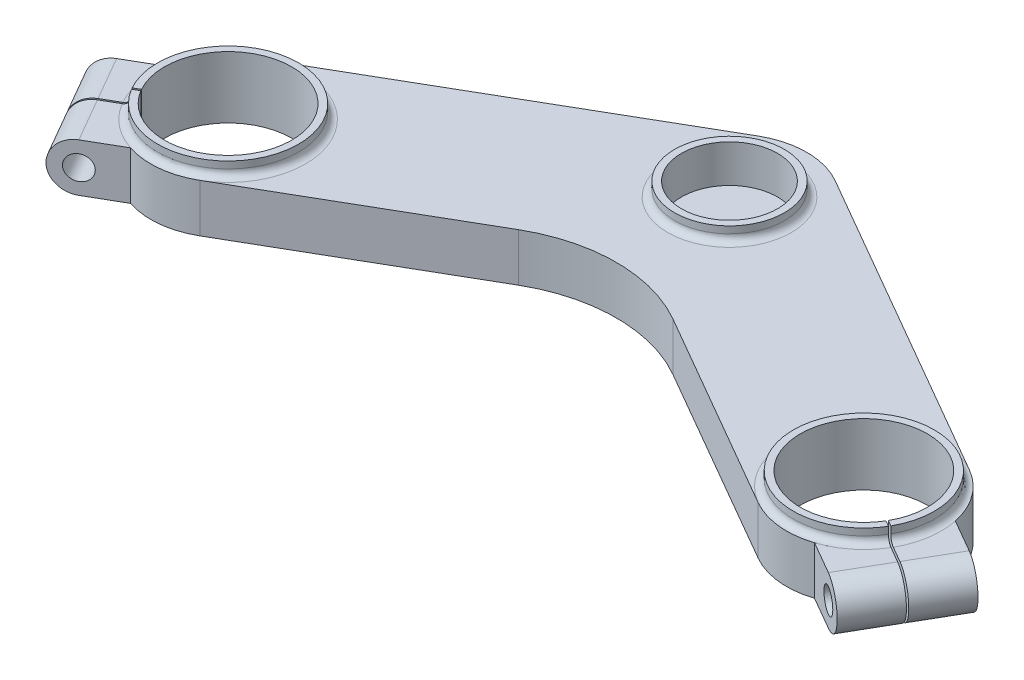
from build123d import *

# Parameters (mm, degrees)
BOSS_EXTRUDE1_DEPTH = 14
FILLET2_R           = 45
SKETCH2_R           = 18.51
CUT_EXTRUDE1_DEPTH  = 139.501096851
SKETCH3_R           = 13.985
CUT_EXTRUDE2_DEPTH  = 7
BOSS_EXTRUDE2_START = -14
BOSS_EXTRUDE2_DEPTH = 14
CUT_EXTRUDE3_DEPTH  = 158.374175717
CUT_EXTRUDE4_DEPTH  = 158.374175717
BOSS_EXTRUDE3_START = 4
SKETCH9_R           = 20.51
SKETCH9_R_2         = 18.51
SKETCH9_R_3         = 15.985
SKETCH9_R_4         = 13.985
BOSS_EXTRUDE3_DEPTH = 4
FILLET5_R           = 2
SKETCH10_R          = 3.5
CUT_EXTRUDE5_DEPTH  = 42
SKETCH11_R          = 3.5
CUT_EXTRUDE6_DEPTH  = 42
CUT_EXTRUDE7_DEPTH  = 42


with BuildPart() as part:
    # Sketch1 → Boss-Extrude1 (new body)
    with BuildSketch(Plane(origin=(0, 0, 0), x_dir=(1, 0, 0), z_dir=(0, 1, 0))):
        with BuildLine():
            Line((-103.75, -33.919328315), (-11.25, 19.485571585))
            ThreePointArc((-11.25, 19.485571585), (0, 22.5), (11.25, 19.485571585))
            Line((11.25, 19.485571585), (103.75, -33.919328315))
            ThreePointArc((103.75, -33.919328315), (111.985571585, -64.6548999), (81.25, -72.890471485))
            Line((81.25, -72.890471485), (0, -25.980762114))
            Line((0, -25.980762114), (-81.25, -72.890471485))
            ThreePointArc((-81.25, -72.890471485), (-111.985571585, -64.6548999), (-103.75, -33.919328315))
        make_face()
    extrude(amount=BOSS_EXTRUDE1_DEPTH)

    # Fillet2
    fillet2_edges = [part.edges().sort_by_distance(p)[0] for p in [
        (0, 7, 25.980762114),
    ]]
    fillet(fillet2_edges, radius=FILLET2_R)

    # Sketch2 → Cut-Extrude1 (cut, through all)
    with BuildSketch(Plane(origin=(0, 14, 0), x_dir=(1, 0, 0), z_dir=(0, 1, 0))):
        with Locations((-92.5, -53.4048999)):
            Circle(SKETCH2_R)
        with Locations((92.5, -53.4048999)):
            Circle(SKETCH2_R)
    extrude(amount=-CUT_EXTRUDE1_DEPTH, mode=Mode.SUBTRACT)

    # Sketch3 → Cut-Extrude2 (cut)
    with BuildSketch(Plane(origin=(0, 14, 0), x_dir=(1, 0, 0), z_dir=(0, 1, 0))):
        Circle(SKETCH3_R)
    extrude(amount=-CUT_EXTRUDE2_DEPTH, mode=Mode.SUBTRACT)

    # Sketch4 → Boss-Extrude2 (add)
    with BuildSketch(Plane(origin=(0, 14, 0), x_dir=(1, 0, 0), z_dir=(0, 1, 0)).offset(BOSS_EXTRUDE2_START)):
        with BuildLine():
            Line((-114.523687548, -48.799773759), (-131.844195624, -58.799773759))
            Line((-131.844195624, -58.799773759), (-116.844195624, -84.780535872))
            Line((-116.844195624, -84.780535872), (-99.523687548, -74.780535872))
            ThreePointArc((-99.523687548, -74.780535872), (-111.985571585, -64.6548999), (-114.523687548, -48.799773759))
        make_face()
        with BuildLine():
            Line((114.523687548, -48.799773759), (131.844195624, -58.799773759))
            Line((131.844195624, -58.799773759), (116.844195624, -84.780535872))
            Line((116.844195624, -84.780535872), (99.523687548, -74.780535872))
            ThreePointArc((99.523687548, -74.780535872), (111.985571585, -64.6548999), (114.523687548, -48.799773759))
        make_face()
    extrude(amount=BOSS_EXTRUDE2_DEPTH)

    # Sketch5 → Cut-Extrude3 (cut, through all)
    with BuildSketch(Plane(origin=(7.5, 0, 12.990381057), x_dir=(0.8660254037844385, 0, -0.5000000000000004), z_dir=(0.5000000000000003, 0, 0.8660254037844384))):
        with BuildLine():
            Line((-143.580309631, 0), (-143.580309631, 14))
            Line((-143.580309631, 14), (-134.580309631, 14))
            ThreePointArc((-134.580309631, 14), (-141.580309631, 7), (-134.580309631, 0))
            Line((-134.580309631, 0), (-143.580309631, 0))
        make_face()
    extrude(amount=-CUT_EXTRUDE3_DEPTH, mode=Mode.SUBTRACT)

    # Sketch6 → Cut-Extrude4 (cut, through all)
    with BuildSketch(Plane(origin=(-7.5, 0, 12.990381057), x_dir=(0.8660254037844385, 0, 0.5000000000000004), z_dir=(-0.5000000000000003, 0, 0.8660254037844384))):
        with BuildLine():
            Line((134.580309631, 14), (143.580309631, 14))
            Line((143.580309631, 14), (143.580309631, 0))
            Line((143.580309631, 0), (134.580309631, 0))
            ThreePointArc((134.580309631, 0), (141.580309631, 7), (134.580309631, 14))
        make_face()
    extrude(amount=-CUT_EXTRUDE4_DEPTH, mode=Mode.SUBTRACT)

    # Sketch9 → Boss-Extrude3 (add)
    # profile 1 of 3: a face of its own
    with BuildSketch(Plane(origin=(0, 14, 0), x_dir=(1, 0, 0), z_dir=(0, 1, 0)).offset(BOSS_EXTRUDE3_START)):
        with Locations((-92.5, -53.4048999)):
            Circle(SKETCH9_R)
        with Locations((-92.5, -53.4048999)):
            Circle(SKETCH9_R_2, mode=Mode.SUBTRACT)
    # profile 2 of 3: a face of its own
    with BuildSketch(Plane(origin=(0, 14, 0), x_dir=(1, 0, 0), z_dir=(0, 1, 0)).offset(BOSS_EXTRUDE3_START)):
        Circle(SKETCH9_R_3)
        Circle(SKETCH9_R_4, mode=Mode.SUBTRACT)
    # profile 3 of 3: a face of its own
    with BuildSketch(Plane(origin=(0, 14, 0), x_dir=(1, 0, 0), z_dir=(0, 1, 0)).offset(BOSS_EXTRUDE3_START)):
        with Locations((92.5, -53.4048999)):
            Circle(SKETCH9_R)
        with Locations((92.5, -53.4048999)):
            Circle(SKETCH9_R_2, mode=Mode.SUBTRACT)
    extrude(amount=-BOSS_EXTRUDE3_DEPTH)

    # Fillet5
    fillet5_edges = [part.edges().sort_by_distance(p)[0] for p in [
        (-113.01, 14, 53.4048999),
        (71.99, 14, 53.4048999),
        (-15.985, 14, 0),
    ]]
    fillet(fillet5_edges, radius=FILLET5_R)

    # Sketch10 → Cut-Extrude5 (cut)
    with BuildSketch(Plane(origin=(7.5, 0, 12.990381057), x_dir=(0.8660254037844625, 0, -0.49999999999995876), z_dir=(0.49999999999995876, 0, 0.8660254037844625))):
        with Locations((-134.580309631, 7)):
            Circle(SKETCH10_R)
    extrude(amount=-CUT_EXTRUDE5_DEPTH, mode=Mode.SUBTRACT)

    # Sketch11 → Cut-Extrude6 (cut)
    with BuildSketch(Plane(origin=(-7.5, 0, 12.990381057), x_dir=(0.8660254037844625, 0, 0.49999999999995876), z_dir=(-0.49999999999995876, 0, 0.8660254037844625))):
        with Locations((134.580309631, 7)):
            Circle(SKETCH11_R)
    extrude(amount=-CUT_EXTRUDE6_DEPTH, mode=Mode.SUBTRACT)

    # Sketch12 → Cut-Extrude7 (cut)
    with BuildSketch(Plane(origin=(0, 18, 0), x_dir=(1, 0, 0), z_dir=(0, 1, 0))):
        Polygon((-92.363302775, -53.614217526), (-129.001019076, -74.767012895), (-129.274413527, -74.348377643), (-92.636697225, -53.195582274), align=None)
        Polygon((129.274413527, -74.348377643), (129.001019076, -74.767012895), (92.363302775, -53.614217526), (92.636697225, -53.195582274), align=None)
    extrude(amount=-CUT_EXTRUDE7_DEPTH, mode=Mode.SUBTRACT)


solid = part.part
